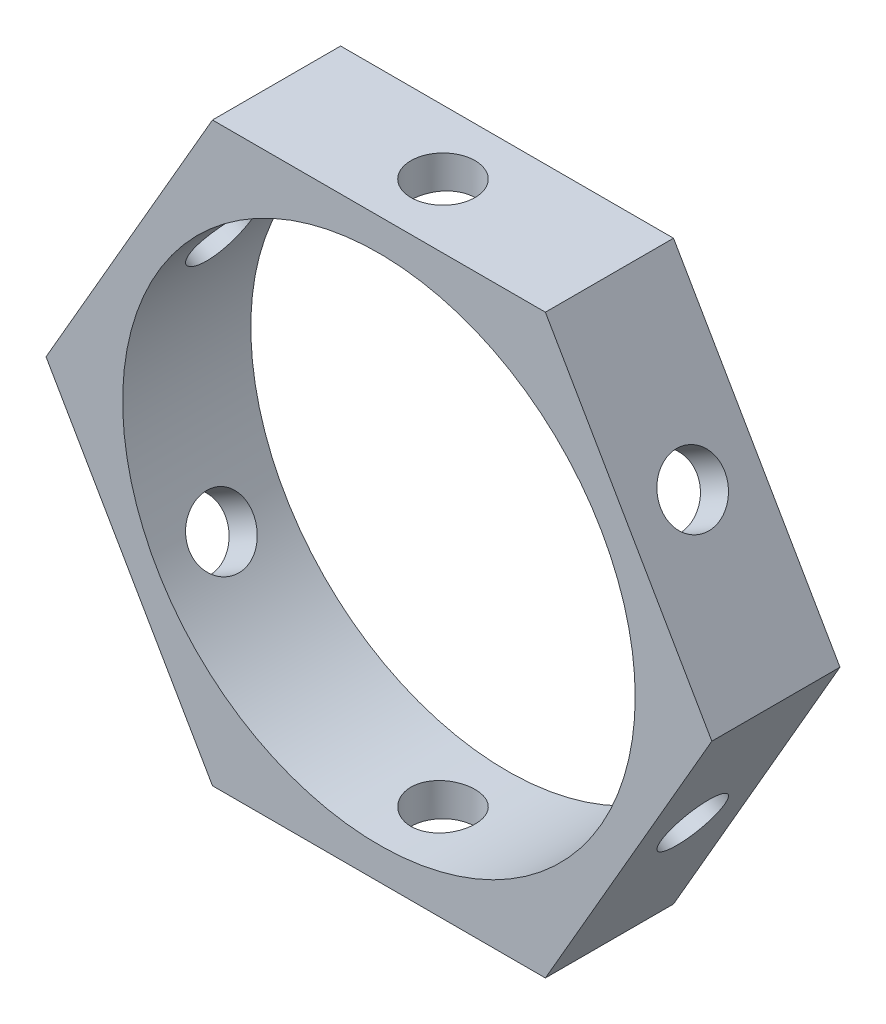
from build123d import *

# Parameters (mm, degrees)
SKETCH1_R          = 20
EXTRUDE1_DEPTH     = 10
SKETCH2_R          = 2.5
CUT_EXTRUDE1_DEPTH = 58.5
SKETCH3_R          = 2.5
CUT_EXTRUDE2_DEPTH = 53.91502624
SKETCH4_R          = 2.5
CUT_EXTRUDE3_DEPTH = 58.500000076


with BuildPart() as part:
    # Sketch1 → Extrude1 (new body)
    with BuildSketch(Plane.XY):
        Polygon((25.980762114, 0), (12.990381057, 22.5), (-12.990381057, 22.5), (-25.980762114, 0), (-12.990381057, -22.5), (12.990381057, -22.5), align=None)
        Circle(SKETCH1_R, mode=Mode.SUBTRACT)
    extrude(amount=EXTRUDE1_DEPTH)

    # Sketch2 → Cut-Extrude1 (cut, through all)
    with BuildSketch(Plane(origin=(19.485571585, 11.25, 0), x_dir=(0, 0, -1), z_dir=(0.8660254037844386, 0.5000000000000001, 0))):
        with Locations((-5, 0)):
            Circle(SKETCH2_R)
    extrude(amount=-CUT_EXTRUDE1_DEPTH, mode=Mode.SUBTRACT)

    # Sketch3 → Cut-Extrude2 (cut, through all)
    with BuildSketch(Plane.XZ.offset(22.5)):
        with Locations((0, 5)):
            Circle(SKETCH3_R)
    extrude(amount=-CUT_EXTRUDE2_DEPTH, mode=Mode.SUBTRACT)

    # Sketch4 → Cut-Extrude3 (cut, through all)
    with BuildSketch(Plane(origin=(19.485571585, -11.25, 0), x_dir=(0, 0, -1), z_dir=(0.8660254037844389, -0.4999999999999995, 0))):
        with Locations((-5, 0)):
            Circle(SKETCH4_R)
    extrude(amount=-CUT_EXTRUDE3_DEPTH, mode=Mode.SUBTRACT)


solid = part.part
